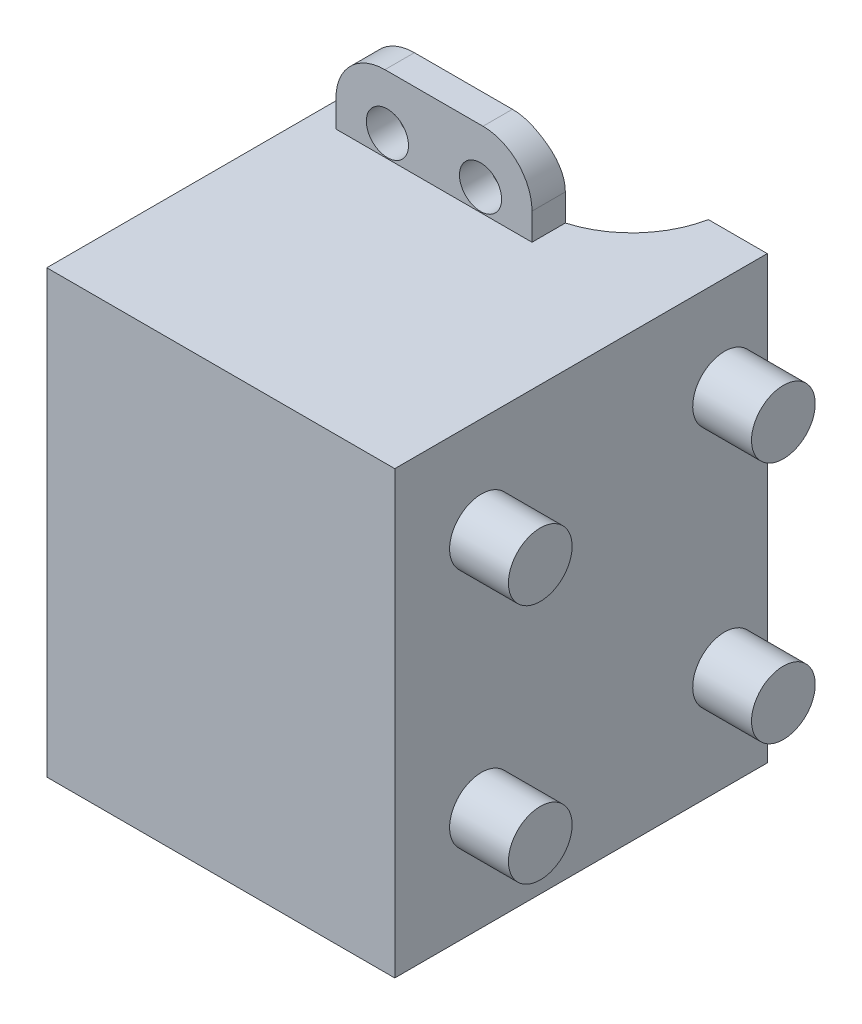
from build123d import *

# Parameters (mm, degrees)
SKETCH1_W           = 25
SKETCH1_H           = 45
BOSS_EXTRUDE1_DEPTH = 30
SKETCH2_W           = 20.5
SKETCH2_H           = 40.5
CUT_EXTRUDE1_DEPTH  = 28
SKETCH3_W           = 20
SKETCH3_H           = 7.75
BOSS_EXTRUDE2_DEPTH = 3
SKETCH5_W           = 8
SKETCH5_H           = 28
CUT_EXTRUDE2_DEPTH  = 2.25
FILLET1_R           = 2
SKETCH6_R           = 2.15
CUT_EXTRUDE3_DEPTH  = 4
FILLET2_R           = 5
SKETCH8_W           = 30
SKETCH8_H           = 45
BOSS_EXTRUDE3_DEPTH = 10.5
SKETCH13_W          = 6
SKETCH13_H          = 45
BOSS_EXTRUDE6_DEPTH = 8
FILLET4_START       = -20.219298246
FILLET4_DEPTH       = 45
FILLET4_START_2     = -27.458286573
FILLET4_2_DEPTH     = 9.488988327
FILLET4_START_3     = 22.530701754
FILLET4_3_DEPTH     = 9.488988328
FILLET4_START_4     = -1
FILLET4_4_OUTLINE_W = 0.25
FILLET4_4_OUTLINE_H = 40.5
FILLET4_4_DEPTH     = 1
SKETCH14_R          = 3.25
BOSS_EXTRUDE7_DEPTH = 6


with BuildPart() as part:
    # Sketch1 → Boss-Extrude1 (new body)
    with BuildSketch(Plane.XY):
        with Locations((-0.657894737, 2.280701754)):
            Rectangle(SKETCH1_W, SKETCH1_H)
    extrude(amount=BOSS_EXTRUDE1_DEPTH)

    # Sketch2 → Cut-Extrude1 (cut)
    with BuildSketch(Plane(origin=(0, 0, 0), x_dir=(-1, 0, 0), z_dir=(0, 0, -1))):
        with Locations((0.657894737, 2.280701754)):
            Rectangle(SKETCH2_W, SKETCH2_H)
    extrude(amount=-CUT_EXTRUDE1_DEPTH, mode=Mode.SUBTRACT)

    # Sketch3 → Boss-Extrude2 (add)
    with BuildSketch(Plane(origin=(0, 0, 0), x_dir=(-1, 0, 0), z_dir=(0, 0, -1))):
        with Locations((0.657894737, 28.655701754)):
            Rectangle(SKETCH3_W, SKETCH3_H)
        with Locations((0.657894737, -24.094298246)):
            Rectangle(SKETCH3_W, SKETCH3_H)
    extrude(amount=-BOSS_EXTRUDE2_DEPTH)

    # Sketch5 → Cut-Extrude2 (cut)
    with BuildSketch(Plane(origin=(0, -17.969298246, 0), x_dir=(1, 0, 0), z_dir=(0, 1, 0))):
        with Locations((-0.657894737, -14)):
            Rectangle(SKETCH5_W, SKETCH5_H)
    extrude(amount=-CUT_EXTRUDE2_DEPTH, mode=Mode.SUBTRACT)

    # Fillet1
    fillet1_edges = [part.edges().sort_by_distance(p)[0] for p in [
        (-4.657894737, -20.219298246, 1.5),
        (3.342105263, -20.219298246, 1.5),
    ]]
    fillet(fillet1_edges, radius=FILLET1_R)

    # Sketch6 → Cut-Extrude3 (cut)
    with BuildSketch(Plane(origin=(0, 0, 0), x_dir=(-1, 0, 0), z_dir=(0, 0, -1))):
        with Locations((-4.092105263, 27.030701754)):
            Circle(SKETCH6_R)
        with Locations((5.407894737, 27.030701754)):
            Circle(SKETCH6_R)
        with Locations((5.407894737, -22.469298246)):
            Circle(SKETCH6_R)
        with Locations((-4.092105263, -22.469298246)):
            Circle(SKETCH6_R)
    extrude(amount=-CUT_EXTRUDE3_DEPTH, mode=Mode.SUBTRACT)

    # Fillet2
    fillet2_edges = [part.edges().sort_by_distance(p)[0] for p in [
        (9.342105263, 32.530701754, 1.5),
        (-10.657894737, 32.530701754, 1.5),
        (9.342105263, -27.969298246, 1.5),
        (-10.657894737, -27.969298246, 1.5),
    ]]
    fillet(fillet2_edges, radius=FILLET2_R)

    # Sketch8 → Boss-Extrude3 (add)
    with BuildSketch(Plane(origin=(11.842105263, 0, 0), x_dir=(0, 0, -1), z_dir=(1, 0, 0))):
        with Locations((-15, 2.280701754)):
            Rectangle(SKETCH8_W, SKETCH8_H)
    extrude(amount=BOSS_EXTRUDE3_DEPTH)

    # Sketch13 → Boss-Extrude6 (add)
    with BuildSketch(Plane(origin=(0, 0, 0), x_dir=(-1, 0, 0), z_dir=(0, 0, -1))):
        with Locations((-19.342105263, 2.280701754)):
            Rectangle(SKETCH13_W, SKETCH13_H)
    extrude(amount=BOSS_EXTRUDE6_DEPTH)

    # Fillet4: read off the stored shape, not the designer's step
    # Fillet4 outline → Fillet4 (add)
    with BuildSketch(Plane(origin=(0, 0, 0), x_dir=(1, 0, 0), z_dir=(0, 1, 0)).offset(FILLET4_START)):
        with BuildLine():
            Line((9.342105263, 0.399404936), (9.342105263, 0))
            Line((9.342105263, 0), (16.342105263, 0))
            Line((16.342105263, 0), (16.342105263, 8))
            ThreePointArc((16.342105263, 8), (13.899861657, 3.225529433), (9.342105263, 0.399404936))
        make_face()
    extrude(amount=FILLET4_DEPTH)

    # Fillet4 2 outline → Fillet4 2 (add)
    with BuildSketch(Plane(origin=(0, 0, 0), x_dir=(1, 0, 0), z_dir=(0, 1, 0)).offset(FILLET4_START_2)):
        with BuildLine():
            Line((6.544146292, 0), (9.342105263, 0))
            Line((9.342105263, 0), (9.342105263, 0.399404936))
            ThreePointArc((9.342105263, 0.399404936), (7.957307527, 0.100354788), (6.544146292, 0))
        make_face()
    extrude(amount=FILLET4_2_DEPTH)

    # Fillet4 3 outline → Fillet4 3 (add)
    with BuildSketch(Plane(origin=(0, 0, 0), x_dir=(1, 0, 0), z_dir=(0, 1, 0)).offset(FILLET4_START_3)):
        with BuildLine():
            Line((6.544146292, 0), (9.342105263, 0))
            Line((9.342105263, 0), (9.342105263, 0.399404936))
            ThreePointArc((9.342105263, 0.399404936), (7.957307527, 0.100354788), (6.544146292, 0))
        make_face()
    extrude(amount=FILLET4_3_DEPTH)

    # Fillet4 4 outline → Fillet4 4 (cut)
    with BuildSketch(Plane.XY.offset(FILLET4_START_4)):
        with BuildLine():
            Line((9.342105263, -27.458286573), (9.342105263, -22.969298246))
            ThreePointArc((9.342105263, -22.969298246), (8.58534724, -25.614085104), (6.544146253, -27.458286493))
            Line((6.544146253, -27.458286493), (9.342105263, -27.458286573))
        make_face()
        with BuildLine():
            Line((9.342105263, 32.019690082), (6.544146252, 32.019690001))
            ThreePointArc((6.544146252, 32.019690001), (8.58534724, 30.175488613), (9.342105263, 27.530701754))
            Line((9.342105263, 27.530701754), (9.342105263, 32.019690082))
        make_face()
        with Locations((9.467105263, 2.280701754)):
            Rectangle(FILLET4_4_OUTLINE_W, FILLET4_4_OUTLINE_H)
    extrude(amount=FILLET4_4_DEPTH, mode=Mode.SUBTRACT)

    # Sketch14 → Boss-Extrude7 (add)
    with BuildSketch(Plane(origin=(22.342105263, 0, 0), x_dir=(0, 0, -1), z_dir=(1, 0, 0))):
        with Locations(Location((-21.156070928, 14.873665711, 0), (0, 0, 90))):
            Circle(SKETCH14_R)
        with Locations(Location((3.643929072, 15.073774065, 0), (0, 0, 90))):
            Circle(SKETCH14_R)
        with Locations(Location((3.643929072, -9.726225935, 0), (0, 0, 90))):
            Circle(SKETCH14_R)
        with Locations(Location((-21.156070928, -9.726225935, 0), (0, 0, 90))):
            Circle(SKETCH14_R)
    extrude(amount=BOSS_EXTRUDE7_DEPTH)


solid = part.part
